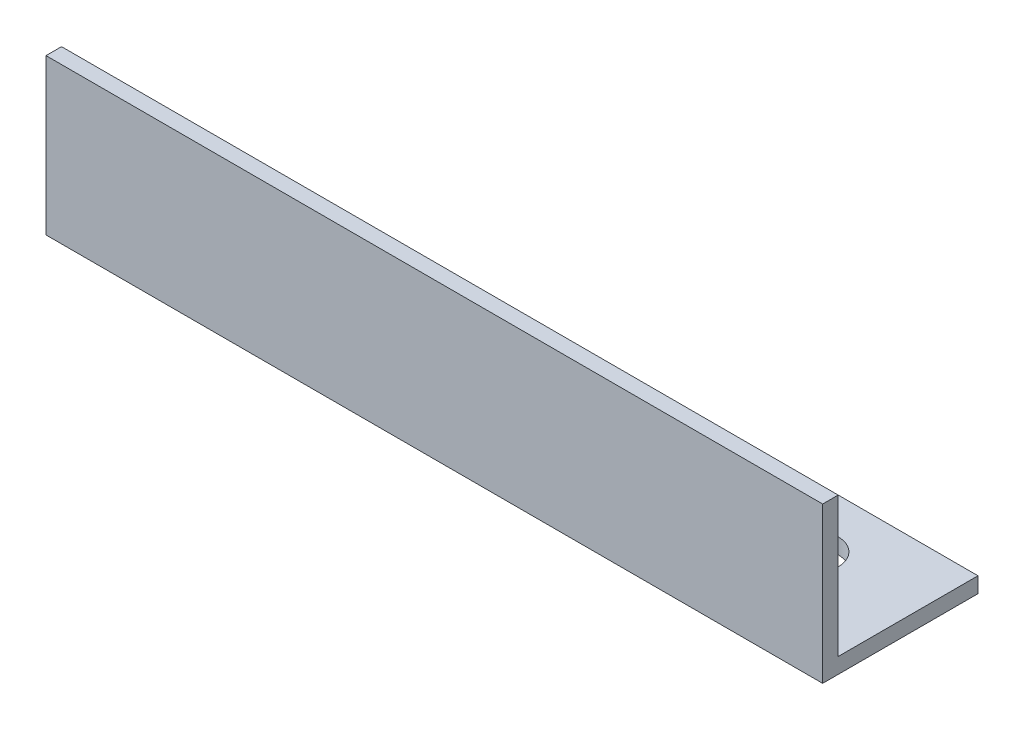
from build123d import *

# Parameters (mm, degrees)
EXTRUDE_1_DEPTH     = 150
SKETCH_2_R          = 5
CUT_EXTRUDE_1_DEPTH = 156.884572681


with BuildPart() as part:
    # Эскиз1 → Вытянуть-Тонкостенный1 (new body)
    with BuildSketch(Plane(origin=(0, 0, 0), x_dir=(0, 0, -1), z_dir=(1, 0, 0))):
        Polygon((30, 0), (0, 0), (0, 30), (3, 30), (3, 3), (30, 3), align=None)
    extrude(amount=EXTRUDE_1_DEPTH)

    # Эскиз2 → Вырез-Вытянуть1 (cut, through all)
    with BuildSketch(Plane.XZ):
        with Locations((130, -18)):
            Circle(SKETCH_2_R)
        with Locations((100, -18)):
            Circle(SKETCH_2_R)
        with Locations((50, -18)):
            Circle(SKETCH_2_R)
        with Locations((20, -18)):
            Circle(SKETCH_2_R)
    extrude(amount=-CUT_EXTRUDE_1_DEPTH, mode=Mode.SUBTRACT)


solid = part.part
